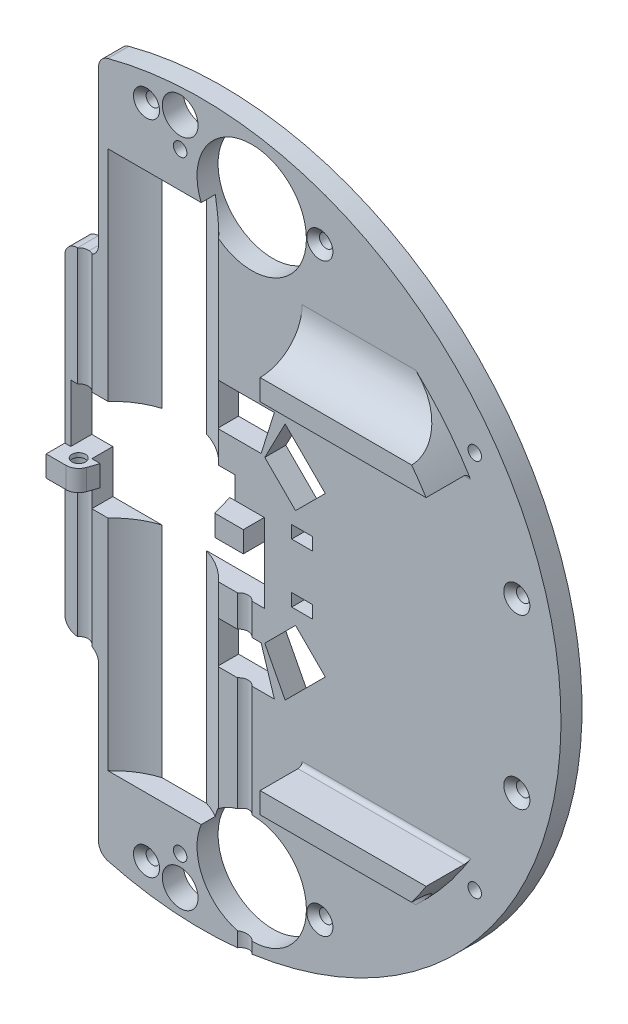
from build123d import *

# Parameters (mm, degrees)
SKETCH1_R               = 1.6
SKETCH1_R_2             = 4.25
SKETCH1_R_3             = 13
BOSS_EXTRUDE2_DEPTH     = 5
BOSS_EXTRUDE3_DEPTH     = 10
FILLET1_R               = 10
FILLET2_R               = 1
SKETCH5_R               = 1.6
CUT_EXTRUDE2_DEPTH      = 10
CHAMFER1_SIZE           = 1.5
CHAMFER2_SIZE           = 1.5
CUT_EXTRUDE3_DEPTH      = 10
CUT_EXTRUDE4_DEPTH      = 64
CUT_EXTRUDE4_DEPTH_BACK = 64
SKETCH10_R              = 17.8
CUT_EXTRUDE5_DEPTH      = 62.5
SKETCH13_W              = 8.207106088
SKETCH13_H              = 5
BOSS_EXTRUDE4_DEPTH     = 5
CUT_EXTRUDE6_DEPTH      = 110
CUT_EXTRUDE6_DEPTH_BACK = 4
SKETCH14_R              = 2.25
CUT_EXTRUDE7_DEPTH      = 15
SKETCH16_W              = 8.411411006
SKETCH16_H              = 5
BOSS_EXTRUDE5_DEPTH     = 5
CUT_EXTRUDE8_DEPTH      = 40
CUT_EXTRUDE8_DEPTH_BACK = 4
SKETCH17_R              = 2.25
CUT_EXTRUDE9_DEPTH      = 7
SKETCH19_R              = 1.6
CUT_EXTRUDE10_DEPTH     = 7
CUT_EXTRUDE11_START     = 45
SKETCH20_R              = 2.25
CUT_EXTRUDE11_DEPTH     = 45
SKETCH21_W              = 63.368942454
SKETCH21_H              = 8
CUT_EXTRUDE12_DEPTH     = 3
SKETCH22_W              = 5
SKETCH22_H              = 3
CUT_EXTRUDE13_DEPTH     = 5
FILLET3_R               = 3


# Some blends are built 0.0001 mm under size
with BuildPart() as part:
    # Sketch1 → Boss-Extrude2 (new body)
    with BuildSketch(Plane(origin=(0, 0, 0), x_dir=(0, 1, 0), z_dir=(0, 0, 1))):
        with BuildLine():
            Line((-40, 24.388755563), (-40, 32.411411006))
            Line((-40, 32.411411006), (40, 32.411411006))
            Line((40, 32.411411006), (40, 24.411411006))
            Line((40, 24.411411006), (81.941033754, 24.411411006))
            ThreePointArc((81.941033754, 24.411411006), (0.011819235, -85.499999183), (-81.947779727, 24.388755563))
            Line((-81.947779727, 24.388755563), (-40, 24.388755563))
        make_face()
        with Locations(Location((-20, -75, 0), (0, 0, 270))):
            Circle(SKETCH1_R, mode=Mode.SUBTRACT)
        with Locations(Location((20, -75, 0), (0, 0, 90))):
            Circle(SKETCH1_R, mode=Mode.SUBTRACT)
        with Locations(Location((-69.5, -28.2, 0), (0, 0, 270))):
            Circle(SKETCH1_R, mode=Mode.SUBTRACT)
        with Locations(Location((-78, 13, 0), (0, 0, 90))):
            Circle(SKETCH1_R, mode=Mode.SUBTRACT)
        with Locations(Location((-79.5, 5, 0), (0, 0, 90))):
            Circle(SKETCH1_R_2, mode=Mode.SUBTRACT)
        with Locations(Location((-69, -12, 0), (0, 0, 90))):
            Circle(SKETCH1_R_3, mode=Mode.SUBTRACT)
        with Locations(Location((69, -12, 0), (0, 0, 270))):
            Circle(SKETCH1_R_3, mode=Mode.SUBTRACT)
        with Locations(Location((79.5, 5, 0), (0, 0, 270))):
            Circle(SKETCH1_R_2, mode=Mode.SUBTRACT)
        with Locations(Location((78, 13, 0), (0, 0, 270))):
            Circle(SKETCH1_R, mode=Mode.SUBTRACT)
        with Locations(Location((69.5, -28.2, 0), (0, 0, 90))):
            Circle(SKETCH1_R, mode=Mode.SUBTRACT)
    extrude(amount=BOSS_EXTRUDE2_DEPTH)

    # Sketch2 → Boss-Extrude3 (add)
    with BuildSketch(Plane.XY.offset(5)):
        with BuildLine():
            Line((60, 45), (24, 45))
            Line((24, 45), (24, 40))
            Line((24, 40), (63.442887702, 40))
            ThreePointArc((63.442887702, 40), (61.772053803, 42.534848876), (60, 45))
        make_face()
        with BuildLine():
            Line((24, -45), (24, -40))
            Line((24, -40), (63.442887702, -40))
            ThreePointArc((63.442887702, -40), (61.772053803, -42.534848876), (60, -45))
            Line((60, -45), (24, -45))
        make_face()
    extrude(amount=BOSS_EXTRUDE3_DEPTH)

    # Fillet1
    fillet1_edges = [part.edges().sort_by_distance(p)[0] for p in [
        (42, -45, 5),
        (42, 45, 5),
    ]]
    fillet(fillet1_edges, radius=FILLET1_R - 0.0001)  # a hair under: the kernel refuses the full size

    # Fillet2
    fillet2_edges = [part.edges().sort_by_distance(p)[0] for p in [
        (43.721443851, 40, 5),
        (43.721443851, -40, 5),
    ]]
    fillet(fillet2_edges, radius=FILLET2_R)

    # Sketch5 → Cut-Extrude2 (cut)
    with BuildSketch(Plane.XY.offset(5)):
        with Locations((65, 45)):
            Circle(SKETCH5_R)
        with Locations((-5, 72.5)):
            Circle(SKETCH5_R)
        with Locations((65, -45)):
            Circle(SKETCH5_R)
        with Locations((-5, -72.5)):
            Circle(SKETCH5_R)
    extrude(amount=-CUT_EXTRUDE2_DEPTH, mode=Mode.SUBTRACT)

    # Chamfer1
    chamfer1_edges = [part.edges().sort_by_distance(p)[0] for p in [
        (73.4, -20, 5),
        (76.6, 20, 5),
        (26.6, -69.5, 5),
        (-11.4, -78, 5),
        (-14.6, 78, 5),
        (29.8, 69.5, 5),
    ]]
    chamfer(chamfer1_edges, length=CHAMFER1_SIZE)

    # Chamfer2
    # the kernel refuses this chamfer: 1.5 mm, written as the material it takes off along each edge
    with BuildSketch(Plane(origin=(-5, -72.5, 0), x_dir=(1, 0, 0), z_dir=(0, -1, 0))) as chamfer2_piece_1:
        Polygon((1.6, CHAMFER2_SIZE), (1.6 + CHAMFER2_SIZE, 0), (1.6, 0), align=None)
    revolve(axis=Axis((-5, -72.5, 0), (0, 0, 1)), mode=Mode.SUBTRACT)
    with BuildSketch(Plane(origin=(65, -45, 0), x_dir=(1, 0, 0), z_dir=(0, -1, 0))) as chamfer2_piece_2:
        Polygon((1.6, CHAMFER2_SIZE), (1.6 + CHAMFER2_SIZE, 0), (1.6, 0), align=None)
    revolve(axis=Axis((65, -45, 0), (0, 0, 1)), mode=Mode.SUBTRACT)
    with BuildSketch(Plane(origin=(-5, 72.5, 0), x_dir=(1, 0, 0), z_dir=(0, -1, 0))) as chamfer2_piece_3:
        Polygon((1.6, CHAMFER2_SIZE), (1.6 + CHAMFER2_SIZE, 0), (1.6, 0), align=None)
    revolve(axis=Axis((-5, 72.5, 0), (0, 0, 1)), mode=Mode.SUBTRACT)
    with BuildSketch(Plane(origin=(65, 45, 0), x_dir=(1, 0, 0), z_dir=(0, -1, 0))) as chamfer2_piece_4:
        Polygon((1.6, CHAMFER2_SIZE), (1.6 + CHAMFER2_SIZE, 0), (1.6, 0), align=None)
    revolve(axis=Axis((65, 45, 0), (0, 0, 1)), mode=Mode.SUBTRACT)

    # Sketch9 → Cut-Extrude3 (cut)
    with BuildSketch(Plane.XY.offset(5)):
        Polygon((14.237615434, -19.486352775), (3.879751058, -19.486352775), (3.879751058, -29.486352775), (17.379751058, -29.486352775), align=None)
        Polygon((15.10847152, -19.115496689), (22.415284964, -11.808683246), (29.486352775, -18.879751058), (19.940411229, -28.425692604), align=None)
        Polygon((17.379751058, 29.486352775), (14.237615434, 19.486352775), (3.879751058, 19.486352775), (3.879751058, 29.486352775), align=None)
        Polygon((15.10847152, 19.115496689), (19.940411229, 28.425692604), (29.486352775, 18.879751058), (22.415284964, 11.808683246), align=None)
    extrude(amount=-CUT_EXTRUDE3_DEPTH, mode=Mode.SUBTRACT)

    # Sketch10 → Cut-Extrude4 (cut, two sides: drawn at the far end of the back side and taken through both)
    with BuildSketch(Plane(origin=(0, 0, 0), x_dir=(-1, 0, 0), z_dir=(0, 1, 0)).offset(-CUT_EXTRUDE4_DEPTH_BACK)):
        with Locations((9, 17)):
            Circle(SKETCH10_R)
    extrude(amount=CUT_EXTRUDE4_DEPTH + CUT_EXTRUDE4_DEPTH_BACK, mode=Mode.SUBTRACT)

    # Sketch11 → Cut-Extrude5 (cut)
    with BuildSketch(Plane.XY.offset(5)):
        Polygon((-26, -1.7), (-31, -1.7), (-31, 12), (-25, 12), (8, 12), (8, 1.7), (15, 1.7), (15, -12), (-26, -12), align=None)
    extrude(amount=-CUT_EXTRUDE5_DEPTH, mode=Mode.SUBTRACT)

    # Sketch13 → Boss-Extrude4 (add)
    with BuildSketch(Plane.XY.offset(5)):
        with Locations((10.896446956, 4.2)):
            Rectangle(SKETCH13_W, SKETCH13_H)
    extrude(amount=BOSS_EXTRUDE4_DEPTH)

    # Sketch14 → Cut-Extrude6 (cut, two sides: drawn at the far end of the back side and taken through both)
    with BuildSketch(Plane.XZ.offset(-1.7).offset(-CUT_EXTRUDE6_DEPTH_BACK)):
        with Locations(Location((10.329881394, 6.439198103, 0), (0, 0, 90))):
            Circle(SKETCH14_R)
    extrude(amount=CUT_EXTRUDE6_DEPTH + CUT_EXTRUDE6_DEPTH_BACK, mode=Mode.SUBTRACT)

    # Sketch15 → Cut-Extrude7 (cut)
    with BuildSketch(Plane.XZ.offset(-1.7)):
        Polygon((6.792893912, 5), (6.792893912, 10), (8.234128763, 10), align=None)
    extrude(amount=-CUT_EXTRUDE7_DEPTH, mode=Mode.SUBTRACT)

    # Sketch16 → Boss-Extrude5 (add)
    with BuildSketch(Plane.XY.offset(5)):
        with Locations((-28.205705503, -4.2)):
            Rectangle(SKETCH16_W, SKETCH16_H)
    extrude(amount=BOSS_EXTRUDE5_DEPTH)

    # Sketch17 → Cut-Extrude8 (cut, two sides: drawn at the far end of the back side and taken through both)
    with BuildSketch(Plane.XZ.offset(6.7).offset(-CUT_EXTRUDE8_DEPTH_BACK)):
        with Locations((-27.66829088, 6.439198103)):
            Circle(SKETCH17_R)
    extrude(amount=CUT_EXTRUDE8_DEPTH + CUT_EXTRUDE8_DEPTH_BACK, mode=Mode.SUBTRACT)

    # Sketch18 → Cut-Extrude9 (cut)
    with BuildSketch(Plane.XZ.offset(6.7)):
        with BuildLine():
            Line((-24, 5), (-24.831401452, 7.415599283))
            ThreePointArc((-24.831401452, 7.415599283), (-25.925895164, 8.881606353), (-27.66829088, 9.43941491))
            Line((-27.66829088, 9.43941491), (-32.411411006, 9.43941491))
            Line((-32.411411006, 9.43941491), (-32.411411006, 10))
            Line((-32.411411006, 10), (-25.720901016, 10))
            Line((-25.720901016, 10), (-24, 10))
            Line((-24, 10), (-24, 5))
        make_face()
    extrude(amount=-CUT_EXTRUDE9_DEPTH, mode=Mode.SUBTRACT)

    # Sketch19 → Cut-Extrude10 (cut)
    with BuildSketch(Plane.XZ.offset(2.7)):
        with Locations(Location((-27.66829088, 6.439198103, 0), (0, 0, 270))):
            Circle(SKETCH19_R)
    extrude(amount=-CUT_EXTRUDE10_DEPTH, mode=Mode.SUBTRACT)

    # Sketch20 → Cut-Extrude11 (cut)
    with BuildSketch(Plane(origin=(0, -1.7, 0), x_dir=(-1, 0, 0), z_dir=(0, 1, 0)).offset(CUT_EXTRUDE11_START)):
        with Locations((27.66829088, 6.439198103)):
            Circle(SKETCH20_R)
    extrude(amount=-CUT_EXTRUDE11_DEPTH, mode=Mode.SUBTRACT)

    # Sketch21 → Cut-Extrude12 (cut)
    with BuildSketch(Plane(origin=(0, 0, 0), x_dir=(1, 0, 0), z_dir=(0, 0, -1))):
        with Locations((38.053519701, 0)):
            Rectangle(SKETCH21_W, SKETCH21_H)
    extrude(amount=-CUT_EXTRUDE12_DEPTH, mode=Mode.SUBTRACT)

    # Sketch22 → Cut-Extrude13 (cut)
    with BuildSketch(Plane(origin=(0, 0, 0), x_dir=(1, 0, 0), z_dir=(0, 0, -1))):
        with Locations((24, -7)):
            Rectangle(SKETCH22_W, SKETCH22_H)
        with Locations((24, 7)):
            Rectangle(SKETCH22_W, SKETCH22_H)
    extrude(amount=-CUT_EXTRUDE13_DEPTH, mode=Mode.SUBTRACT)

    # Fillet3
    fillet3_edges = [part.edges().sort_by_distance(p)[0] for p in [
        (-32.411411006, 40, 2.5),
        (-24.411411006, 40, 2.5),
        (-24.411411006, 81.941033754, 2.5),
        (-24.388755563, -81.947779727, 2.5),
        (-24.388755563, -40, 2.5),
        (-32.411411006, -40, 2.5),
    ]]
    fillet(fillet3_edges, radius=FILLET3_R)


solid = part.part
